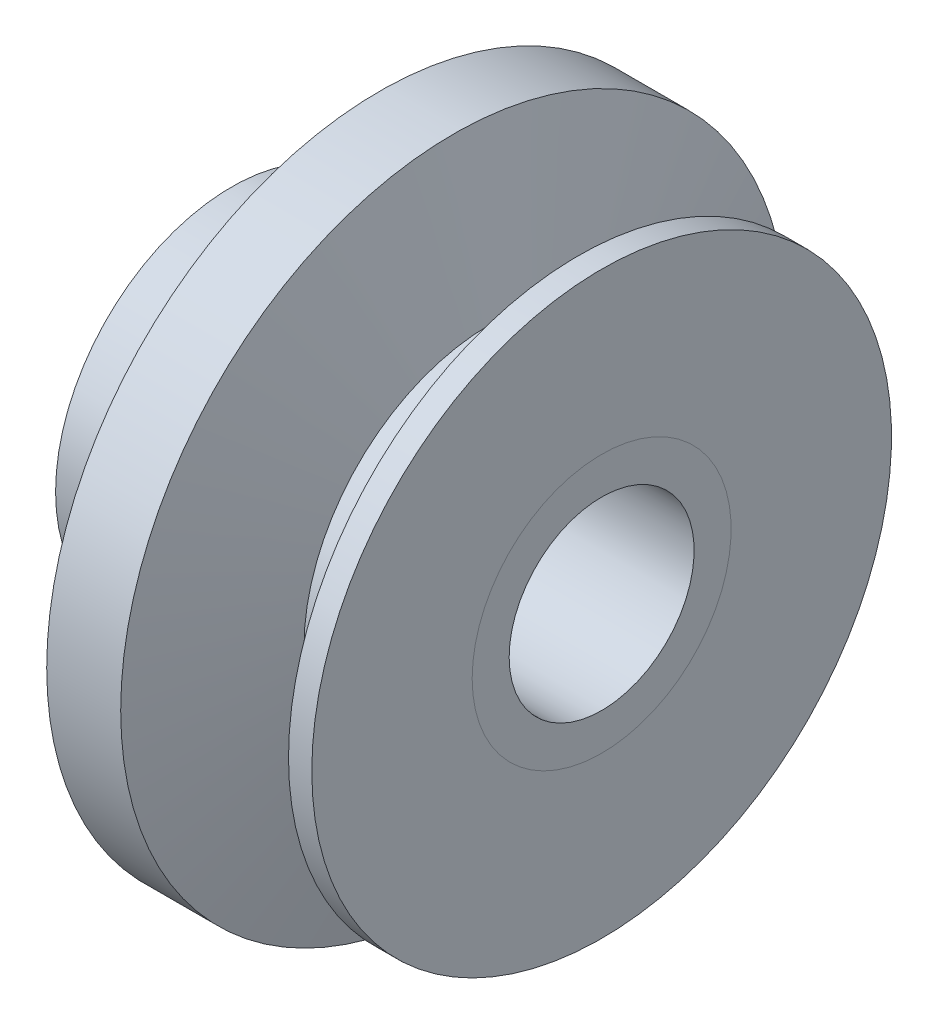
from build123d import *

# Parameters (mm, degrees)
SKETCH5_W = 12.7
SKETCH5_H = 3.175


# Read off the part's stored shape, not the designer's step: Revolve1
with BuildPart() as part:
    # Revolve1 outline → Revolve1 (revolve)
    with BuildSketch(Plane.YX):
        Polygon((11.1125, 0), (11.1125, -12.7), (15.112500017, -12.7), (15.112500017, 0), (28.575, 0), (28.575, 6.35), (15.985000034, 9.489039547), (15.985000034, 14.834987657), (24.875000034, 17.051513602), (24.875000034, 19.05), (11.1125, 19.05), (11.1125, 6.35), (8.9375, 6.35), (8.9375, 0), align=None)
    revolve(axis=Axis((0, 0, 0), (1, 0, 0)))


with BuildPart() as body_2:
    # Sketch5 → Revolve2 (revolve)
    with BuildSketch(Plane.XY, mode=Mode.PRIVATE) as revolve2_sk:
        with Locations((12.7, 9.525)):
            Rectangle(SKETCH5_W, SKETCH5_H)
        with Locations((-6.35, 9.525)):
            Rectangle(SKETCH5_W, SKETCH5_H)
    revolve(revolve2_sk.sketch.rotate(Axis((0, 0, 0), (1, 0, 0)), 90), axis=Axis((0, 0, 0), (1, 0, 0)))


solid = Compound([part.part, body_2.part])
